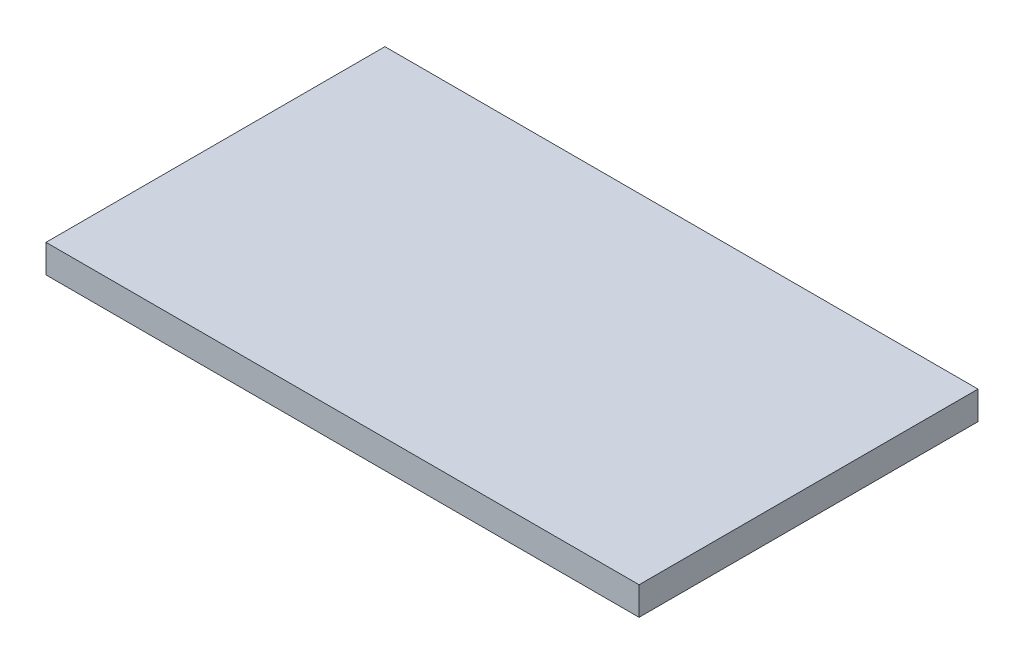
from build123d import *

# Parameters (mm, degrees)
SKETCH1_W           = 210
SKETCH1_H           = 120
BOSS_EXTRUDE1_DEPTH = 10


with BuildPart() as part:
    # Sketch1 → Boss-Extrude1 (new body)
    with BuildSketch(Plane(origin=(0, 0, 0), x_dir=(1, 0, 0), z_dir=(0, 1, 0))):
        with Locations((105, 60)):
            Rectangle(SKETCH1_W, SKETCH1_H)
    extrude(amount=BOSS_EXTRUDE1_DEPTH)


solid = part.part
